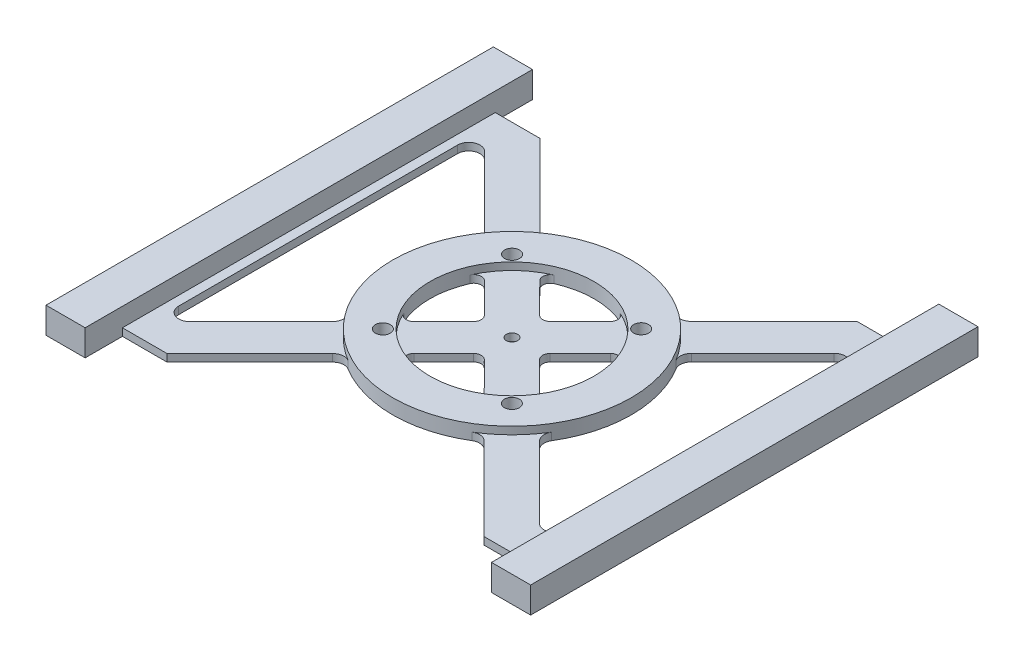
from build123d import *
from build123d.topology import SkipClean

# Parameters (mm, degrees)
SKETCH1_R             = 32
SKETCH1_R_2           = 22
BOSS_EXTRUDE2_DEPTH   = 4
SKETCH3_W             = 10.5
SKETCH3_H             = 120
BOSS_EXTRUDE4_DEPTH   = 7
BOSS_EXTRUDE4_2_DEPTH = 7
BOSS_EXTRUDE5_DEPTH   = 2
SKETCH5_R             = 1.5
CUT_EXTRUDE1_DEPTH    = 4
SKETCH6_R             = 2
CUT_EXTRUDE2_DEPTH    = 4


with BuildPart() as part:
    # Sketch1 → Boss-Extrude2 (new body)
    with BuildSketch(Plane(origin=(0, 0, 0), x_dir=(1, 0, 0), z_dir=(0, 1, 0))):
        Circle(SKETCH1_R)
        Circle(SKETCH1_R_2, mode=Mode.SUBTRACT)
    extrude(amount=BOSS_EXTRUDE2_DEPTH)



with BuildPart() as body_2:
    # Sketch3 → Boss-Extrude4 (new body)
    with BuildSketch(Plane(origin=(0, 0, 0), x_dir=(1, 0, 0), z_dir=(0, 1, 0))):
        with Locations((-59.75, 0)):
            Rectangle(SKETCH3_W, SKETCH3_H)
    extrude(amount=BOSS_EXTRUDE4_DEPTH)


with BuildPart() as body_3:
    # Sketch3 → Boss-Extrude4 2 (new body)
    with BuildSketch(Plane(origin=(0, 0, 0), x_dir=(1, 0, 0), z_dir=(0, 1, 0))):
        with Locations((59.75, 0)):
            Rectangle(SKETCH3_W, SKETCH3_H)
    extrude(amount=BOSS_EXTRUDE4_2_DEPTH)


with BuildPart() as part_1:
    with SkipClean():  # the faces are left unmerged after this step: merging them gives an invalid solid
        add(part.part)

        add(body_2.part)  # Boss-Extrude5 merges body 2

        add(body_3.part)  # Boss-Extrude5 merges body 3
        # Sketch4 → Boss-Extrude5 (add)
        with BuildSketch(Plane(origin=(0, 0, 0), x_dir=(1, 0, 0), z_dir=(0, 1, 0))):
            with BuildLine():
                Line((-54.5, 50), (-42.5, 50))
                Line((-42.5, 50), (-20.316435899, 27.780252561))
                ThreePointArc((-20.316435899, 27.780252561), (-18.551903635, 26.921342904), (-16.633954414, 27.336999845))
                ThreePointArc((-16.633954414, 27.336999845), (0, 32), (16.633954414, 27.336999845))
                ThreePointArc((16.633954414, 27.336999845), (18.551903635, 26.921342904), (20.316435899, 27.780252561))
                Line((20.316435899, 27.780252561), (42.5, 50))
                Line((42.5, 50), (54.5, 50))
                Line((54.5, 50), (54.5, -50))
                Line((54.5, -50), (42.5, -50))
                Line((42.5, -50), (20.316435899, -27.780252561))
                ThreePointArc((20.316435899, -27.780252561), (18.551903635, -26.921342904), (16.633954414, -27.336999845))
                ThreePointArc((16.633954414, -27.336999845), (0, -32), (-16.633954414, -27.336999845))
                ThreePointArc((-16.633954414, -27.336999845), (-18.551903635, -26.921342904), (-20.316435899, -27.780252561))
                Line((-20.316435899, -27.780252561), (-42.5, -50))
                Line((-42.5, -50), (-54.5, -50))
                Line((-54.5, -50), (-54.5, 50))
            make_face()
            with BuildLine():
                Line((-52, -37.403142366), (-52, 37.403142366))
                ThreePointArc((-52, 37.403142366), (-50.146920927, 40.175248495), (-46.876951741, 39.522733386))
                Line((-46.876951741, 39.522733386), (-27.747104804, 20.361683992))
                ThreePointArc((-27.747104804, 20.361683992), (-26.891072048, 18.595754257), (-27.309854229, 16.678485003))
                ThreePointArc((-27.309854229, 16.678485003), (-32, 0), (-27.309854229, -16.678485003))
                ThreePointArc((-27.309854229, -16.678485003), (-26.891072048, -18.595754257), (-27.747104804, -20.361683992))
                Line((-27.747104804, -20.361683992), (-46.876951741, -39.522733386))
                ThreePointArc((-46.876951741, -39.522733386), (-50.146920927, -40.175248495), (-52, -37.403142366))
            make_face(mode=Mode.SUBTRACT)
            with BuildLine():
                Line((52, -37.403142366), (52, 37.403142366))
                ThreePointArc((52, 37.403142366), (50.146920927, 40.175248495), (46.876951741, 39.522733386))
                Line((46.876951741, 39.522733386), (27.747104804, 20.361683992))
                ThreePointArc((27.747104804, 20.361683992), (26.891072048, 18.595754257), (27.309854229, 16.678485003))
                ThreePointArc((27.309854229, 16.678485003), (32, 0), (27.309854229, -16.678485003))
                ThreePointArc((27.309854229, -16.678485003), (26.891072048, -18.595754257), (27.747104804, -20.361683992))
                Line((27.747104804, -20.361683992), (46.876951741, -39.522733386))
                ThreePointArc((46.876951741, -39.522733386), (50.146920927, -40.175248495), (52, -37.403142366))
            make_face(mode=Mode.SUBTRACT)
            with BuildLine():
                Line((-8.829338029, -1.41306068), (-16.884830668, -9.481692534))
                ThreePointArc((-16.884830668, -9.481692534), (-18.667420028, -10.034629474), (-20.130215791, -8.875495039))
                ThreePointArc((-20.130215791, -8.875495039), (-22, 0), (-20.130215791, 8.875495039))
                ThreePointArc((-20.130215791, 8.875495039), (-18.667420028, 10.034629474), (-16.884830668, 9.481692534))
                Line((-16.884830668, 9.481692534), (-8.829338029, 1.41306068))
                ThreePointArc((-8.829338029, 1.41306068), (-8.244703535, 0), (-8.829338029, -1.41306068))
            make_face(mode=Mode.SUBTRACT)
            with BuildLine():
                Line((8.829338029, -1.41306068), (16.884830668, -9.481692534))
                ThreePointArc((16.884830668, -9.481692534), (18.667420028, -10.034629474), (20.130215791, -8.875495039))
                ThreePointArc((20.130215791, -8.875495039), (22, 0), (20.130215791, 8.875495039))
                ThreePointArc((20.130215791, 8.875495039), (18.667420028, 10.034629474), (16.884830668, 9.481692534))
                Line((16.884830668, 9.481692534), (8.829338029, 1.41306068))
                ThreePointArc((8.829338029, 1.41306068), (8.244703535, 0), (8.829338029, -1.41306068))
            make_face(mode=Mode.SUBTRACT)
            with BuildLine():
                Line((-9.454161763, 16.900261103), (-1.415365506, 8.848352865))
                ThreePointArc((-1.415365506, 8.848352865), (0, 8.261413545), (1.415365506, 8.848352865))
                Line((1.415365506, 8.848352865), (9.454161763, 16.900261103))
                ThreePointArc((9.454161763, 16.900261103), (10.00419278, 18.683749248), (8.842675883, 20.144653962))
                ThreePointArc((8.842675883, 20.144653962), (0, 22), (-8.842675883, 20.144653962))
                ThreePointArc((-8.842675883, 20.144653962), (-10.00419278, 18.683749248), (-9.454161763, 16.900261103))
            make_face(mode=Mode.SUBTRACT)
            with BuildLine():
                Line((9.454161763, -16.900261103), (1.415365506, -8.848352865))
                ThreePointArc((1.415365506, -8.848352865), (0, -8.261413545), (-1.415365506, -8.848352865))
                Line((-1.415365506, -8.848352865), (-9.454161763, -16.900261103))
                ThreePointArc((-9.454161763, -16.900261103), (-10.00419278, -18.683749248), (-8.842675883, -20.144653962))
                ThreePointArc((-8.842675883, -20.144653962), (0, -22), (8.842675883, -20.144653962))
                ThreePointArc((8.842675883, -20.144653962), (10.00419278, -18.683749248), (9.454161763, -16.900261103))
            make_face(mode=Mode.SUBTRACT)
        extrude(amount=BOSS_EXTRUDE5_DEPTH)

    # Sketch5 → Cut-Extrude1 (cut)
    with SkipClean():  # the faces are left unmerged after this step: merging them gives an invalid solid
        with BuildSketch(Plane(origin=(0, 2, 0), x_dir=(1, 0, 0), z_dir=(0, 1, 0))):
            Circle(SKETCH5_R)
        extrude(amount=-CUT_EXTRUDE1_DEPTH, mode=Mode.SUBTRACT)

    # Sketch6 → Cut-Extrude2 (cut)
    with SkipClean():  # the faces are left unmerged after this step: merging them gives an invalid solid
        with BuildSketch(Plane.XZ):
            with Locations((-17.309993329, -17.338227446)):
                Circle(SKETCH6_R)
            with Locations((17.309993329, -17.338227446)):
                Circle(SKETCH6_R)
            with Locations((17.309993329, 17.338227446)):
                Circle(SKETCH6_R)
            with Locations((-17.309993329, 17.338227446)):
                Circle(SKETCH6_R)
        extrude(amount=-CUT_EXTRUDE2_DEPTH, mode=Mode.SUBTRACT)


solid = part_1.part
